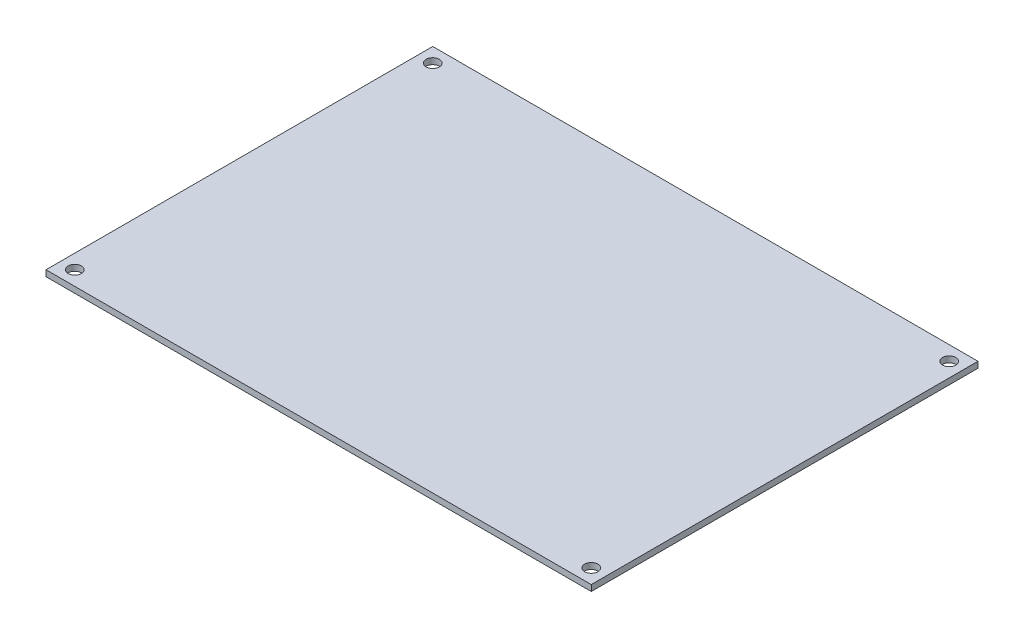
from build123d import *

# Parameters (mm, degrees)
SKETCH1_W           = 144.145
SKETCH1_H           = 102.235
SKETCH1_R           = 1.7526
BOSS_EXTRUDE1_DEPTH = 1.6


with BuildPart() as part:
    # Sketch1 → Boss-Extrude1 (new body)
    with BuildSketch(Plane(origin=(0, 0, 0), x_dir=(1, 0, 0), z_dir=(0, 1, 0))):
        with Locations((72.0725, 51.1175)):
            Rectangle(SKETCH1_W, SKETCH1_H)
        with Locations((3.815, 98.42)):
            Circle(SKETCH1_R, mode=Mode.SUBTRACT)
        with Locations((140.33, 98.42)):
            Circle(SKETCH1_R, mode=Mode.SUBTRACT)
        with Locations((140.33, 3.815)):
            Circle(SKETCH1_R, mode=Mode.SUBTRACT)
        with Locations((3.815, 3.815)):
            Circle(SKETCH1_R, mode=Mode.SUBTRACT)
    extrude(amount=BOSS_EXTRUDE1_DEPTH)


solid = part.part
